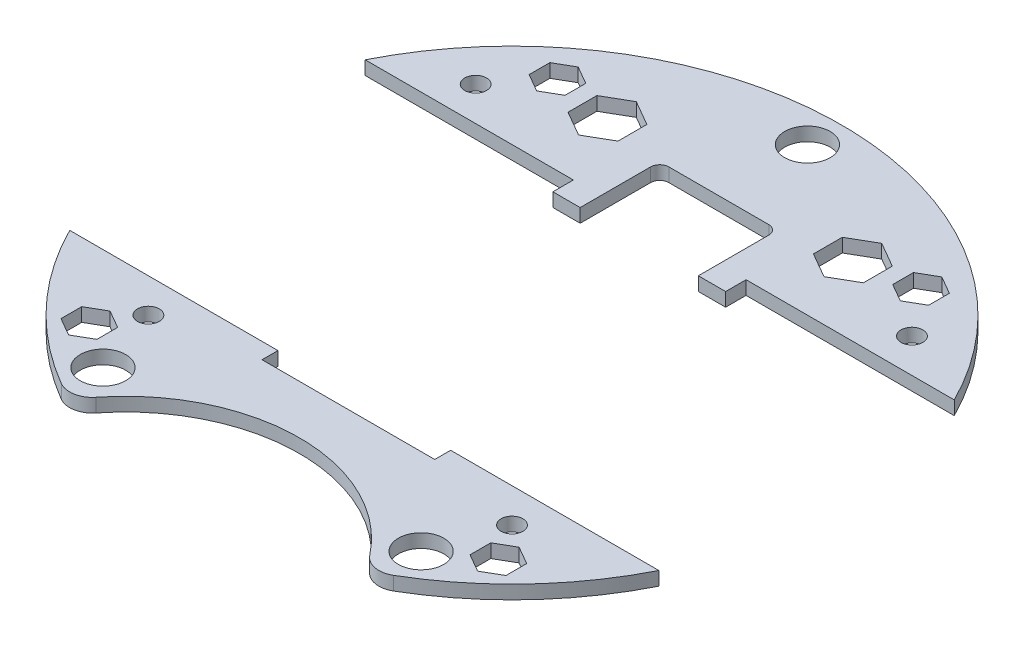
from build123d import *

# Parameters (mm, degrees)
BOSS_EXTRUDE1_DEPTH  = 3
SOLENOID_PLACEMENT_W = 38
SOLENOID_PLACEMENT_H = 64
CUT_EXTRUDE1_DEPTH   = 103.574363269
CUT_EXTRUDE5_DEPTH   = 103.574363269
SKETCH6_R            = 2.4
CUT_EXTRUDE6_DEPTH   = 103.574363269
CUT_EXTRUDE3_DEPTH   = 103.574363269
CUT_EXTRUDE7_DEPTH   = 98.289516393
SKETCH8_R            = 5
CUT_EXTRUDE9_DEPTH   = 98.289516393
SKETCH9_R            = 5
CUT_EXTRUDE11_DEPTH  = 98.289516393
CUT_EXTRUDE12_DEPTH  = 98.289516393


with BuildPart() as part:
    # Sketch1 → Boss-Extrude1 (new body)
    with BuildSketch(Plane(origin=(0, 0, 0), x_dir=(1, 0, 0), z_dir=(0, 1, 0))):
        with BuildLine():
            ThreePointArc((36.543377003, -62.616544118), (0, 72.5), (-36.543377003, -62.616544118))
            ThreePointArc((-36.543377003, -62.616544118), (-33.085954668, -63.20954405), (-30.089832649, -61.38507948))
            ThreePointArc((-30.089832649, -61.38507948), (0, -46.75), (30.089832649, -61.38507948))
            ThreePointArc((30.089832649, -61.38507948), (33.085954668, -63.20954405), (36.543377003, -62.616544118))
        make_face()
    extrude(amount=BOSS_EXTRUDE1_DEPTH)

    # solenoid placement → Cut-Extrude1 (cut, through all)
    with BuildSketch(Plane(origin=(0, 3, 0), x_dir=(1, 0, 0), z_dir=(0, 1, 0))):
        with Locations((0, -4)):
            Rectangle(SOLENOID_PLACEMENT_W, SOLENOID_PLACEMENT_H)
    extrude(amount=-CUT_EXTRUDE1_DEPTH, mode=Mode.SUBTRACT)

    # Sketch5 → Cut-Extrude5 (cut, through all)
    with BuildSketch(Plane(origin=(0, 3, 0), x_dir=(1, 0, 0), z_dir=(0, 1, 0))):
        Polygon((-21.5, 51.175426481), (-27, 54.350852961), (-32.5, 51.175426481), (-32.5, 44.824573519), (-27, 41.649147039), (-21.5, 44.824573519), align=None)
        Polygon((21.5, 51.175426481), (21.5, 44.824573519), (27, 41.649147039), (32.5, 44.824573519), (32.5, 51.175426481), (27, 54.350852961), align=None)
    extrude(amount=-CUT_EXTRUDE5_DEPTH, mode=Mode.SUBTRACT)

    # Sketch6 → Cut-Extrude6 (cut, through all)
    with BuildSketch(Plane(origin=(0, 3, 0), x_dir=(1, 0, 0), z_dir=(0, 1, 0))):
        with Locations((40, -40)):
            Circle(SKETCH6_R)
        with Locations((-40, -40)):
            Circle(SKETCH6_R)
        with Locations((48, 40)):
            Circle(SKETCH6_R)
        with Locations((-48, 40)):
            Circle(SKETCH6_R)
    extrude(amount=-CUT_EXTRUDE6_DEPTH, mode=Mode.SUBTRACT)

    # Sketch3 → Cut-Extrude3 (cut, through all)
    with BuildSketch(Plane(origin=(0, 3, 0), x_dir=(1, 0, 0), z_dir=(0, 1, 0))):
        Polygon((-19, 28), (-19, 32.5), (-72.5, 32.5), (-72.5, -32.5), (72.5, -32.5), (72.5, 32.5), (19, 32.5), (19, 28), align=None)
    extrude(amount=-CUT_EXTRUDE3_DEPTH, mode=Mode.SUBTRACT)


with BuildPart() as cut_extrude3_piece_1:
    # of the separate pieces the step leaves, piece 1, a body of its own (cut_extrude3_pieces)
    add(part.part.solids().sort_by_distance((64.807406984, 0, -32.5))[0])

    # Sketch7 → Cut-Extrude7 (cut, through all)
    with BuildSketch(Plane(origin=(0, 3, 0), x_dir=(1, 0, 0), z_dir=(0, 1, 0))):
        with BuildLine():
            Line((13, 28), (13, 43.5))
            ThreePointArc((13, 43.5), (12.414213562, 44.914213562), (11, 45.5))
            Line((11, 45.5), (-11, 45.5))
            ThreePointArc((-11, 45.5), (-12.414213562, 44.914213562), (-13, 43.5))
            Line((-13, 43.5), (-13, 28))
            Line((-13, 28), (13, 28))
        make_face()
    extrude(amount=-CUT_EXTRUDE7_DEPTH, mode=Mode.SUBTRACT)

    # Sketch9 → Cut-Extrude11 (cut, through all)
    with BuildSketch(Plane.XZ.offset(-3)):
        with Locations((0, -65)):
            Circle(SKETCH9_R)
    extrude(amount=CUT_EXTRUDE11_DEPTH, mode=Mode.SUBTRACT)


with BuildPart() as cut_extrude3_piece_2:
    # of the separate pieces the step leaves, piece 2, a body of its own (cut_extrude3_pieces)
    add(part.part.solids().sort_by_distance((-36.543377003, 0, 62.616544118))[0])

    # Sketch8 → Cut-Extrude9 (cut, through all)
    with BuildSketch(Plane.XZ.offset(-3)):
        with Locations((35, 55)):
            Circle(SKETCH8_R)
        with Locations((-35, 55)):
            Circle(SKETCH8_R)
    extrude(amount=CUT_EXTRUDE9_DEPTH, mode=Mode.SUBTRACT)


with BuildPart() as cut_extrude12_tool:
    # Sketch10 → Cut-Extrude12 (new, through all)
    with BuildSketch(Plane(origin=(0, 3, 0), x_dir=(1, 0, 0), z_dir=(0, 1, 0))):
        Polygon((48.95, -45.719466437), (45, -43.438932873), (41.05, -45.719466437), (41.05, -50.280533563), (45, -52.561067127), (48.95, -50.280533563), align=None)
        Polygon((-48.95, -50.280533563), (-48.95, -45.719466437), (-45, -43.438932873), (-41.05, -45.719466437), (-41.05, -50.280533563), (-45, -52.561067127), align=None)
        Polygon((-43.95, 52.280533563), (-40, 54.561067127), (-36.05, 52.280533563), (-36.05, 47.719466437), (-40, 45.438932873), (-43.95, 47.719466437), align=None)
        Polygon((40, 54.561067127), (36.05, 52.280533563), (36.05, 47.719466437), (40, 45.438932873), (43.95, 47.719466437), (43.95, 52.280533563), align=None)
    extrude(amount=-CUT_EXTRUDE12_DEPTH)


with BuildPart() as cut_extrude3_piece_1_1:
    add(cut_extrude3_piece_1.part)

    # Cut-Extrude12: cut by cut_extrude12_tool
    add(cut_extrude12_tool.part, mode=Mode.SUBTRACT)


with BuildPart() as cut_extrude3_piece_2_1:
    add(cut_extrude3_piece_2.part)

    # Cut-Extrude12: cut by cut_extrude12_tool
    add(cut_extrude12_tool.part, mode=Mode.SUBTRACT)


solid = Compound([cut_extrude3_piece_1_1.part, cut_extrude3_piece_2_1.part])
